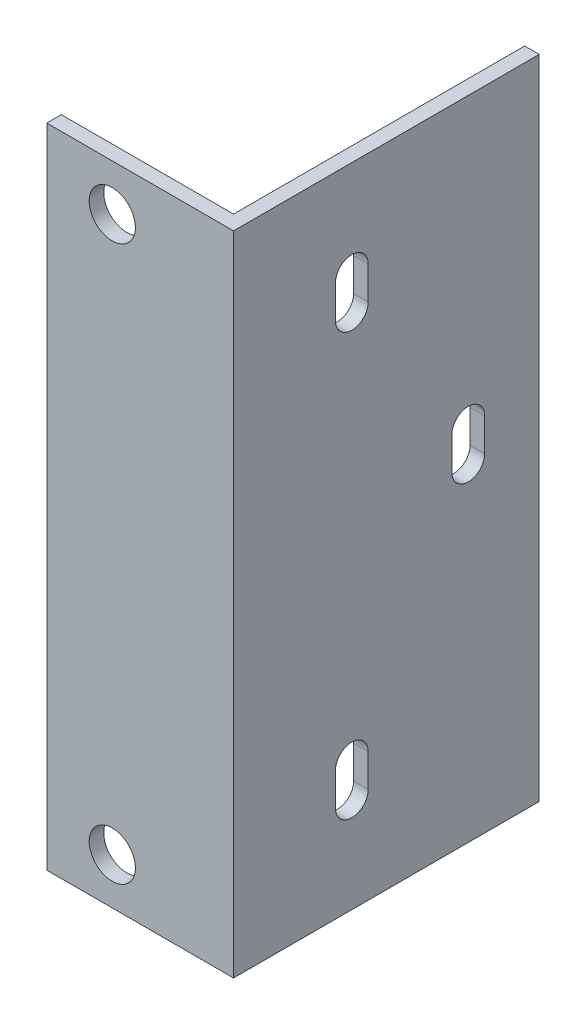
from build123d import *

# Parameters (mm, degrees)
SKETCH1_W           = 25.6624
SKETCH1_H           = 88.9
SKETCH1_R           = 3.175
BOSS_EXTRUDE1_DEPTH = 2
SKETCH2_W           = 2
SKETCH2_H           = 88.9
BOSS_EXTRUDE2_DEPTH = 40
CUT_EXTRUDE1_DEPTH  = 20


with BuildPart() as part:
    # Sketch1 → Boss-Extrude1 (new body)
    with BuildSketch(Plane.XY):
        with Locations((3.8312, 0)):
            Rectangle(SKETCH1_W, SKETCH1_H)
        with Locations((0, -38.1)):
            Circle(SKETCH1_R, mode=Mode.SUBTRACT)
        with Locations((0, 38.1)):
            Circle(SKETCH1_R, mode=Mode.SUBTRACT)
    extrude(amount=-BOSS_EXTRUDE1_DEPTH)

    # Sketch2 → Boss-Extrude2 (add)
    with BuildSketch(Plane(origin=(0, 0, -2), x_dir=(-1, 0, 0), z_dir=(0, 0, -1))):
        with Locations((-15.6624, 0)):
            Rectangle(SKETCH2_W, SKETCH2_H)
    extrude(amount=BOSS_EXTRUDE2_DEPTH)

    # Sketch3 → Cut-Extrude1 (cut)
    with BuildSketch(Plane(origin=(16.6624, 0, 0), x_dir=(0, 0, -1), z_dir=(1, 0, 0))):
        with BuildLine():
            Line((14, -26.75), (14, -31.25))
            ThreePointArc((14, -31.25), (16.25, -33.5), (18.5, -31.25))
            Line((18.5, -31.25), (18.5, -26.75))
            ThreePointArc((18.5, -26.75), (16.25, -24.5), (14, -26.75))
        make_face()
        with BuildLine():
            Line((18.5, 26.75), (18.5, 31.25))
            ThreePointArc((18.5, 31.25), (16.25, 33.5), (14, 31.25))
            Line((14, 31.25), (14, 26.75))
            ThreePointArc((14, 26.75), (16.25, 24.5), (18.5, 26.75))
        make_face()
        with BuildLine():
            Line((30, 5.2), (30, 0.7))
            ThreePointArc((30, 0.7), (32.25, -1.55), (34.5, 0.7))
            Line((34.5, 0.7), (34.5, 5.2))
            ThreePointArc((34.5, 5.2), (32.25, 7.45), (30, 5.2))
        make_face()
    extrude(amount=-CUT_EXTRUDE1_DEPTH, mode=Mode.SUBTRACT)


solid = part.part
